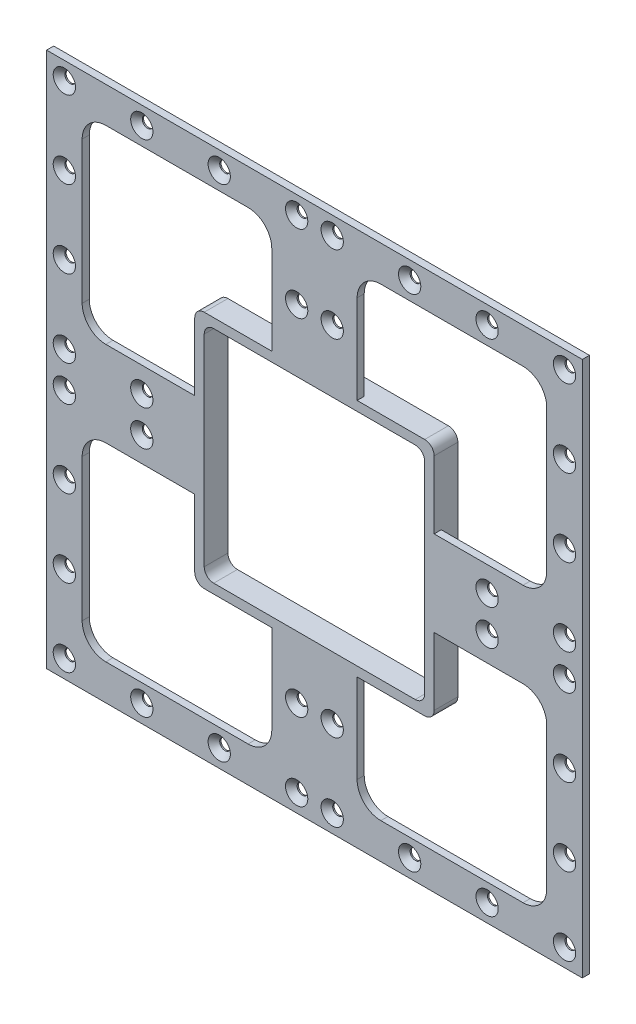
from build123d import *

# Parameters (mm, degrees)
SKETCH1_W              = 226
SKETCH1_H              = 226
BOSS_EXTRUDE1_DEPTH    = 3
SKETCH2_W              = 80
SKETCH2_H              = 80
CUT_EXTRUDE2_DEPTH     = 160.834289187
FILLET1_R              = 10
LPATTERN2_COUNT        = 2
LPATTERN2_PITCH        = 116
LPATTERN2_COUNT_DIR2   = 2
LPATTERN2_PITCH_DIR2   = 116
FILLET1_OF_LPATTERN2_R = 10
LPATTERN8_COUNT        = 4
LPATTERN8_PITCH        = 32.666666667
LPATTERN8_COUNT_DIR2   = 4
LPATTERN8_PITCH_DIR2   = 32.666666667
CUT_EXTRUDE3_REACH     = 161.834
SKETCH14_W             = 101
SKETCH14_H             = 101
SKETCH15_W             = 101
SKETCH15_H             = 101
SKETCH15_W_2           = 93
SKETCH15_H_2           = 93
BOSS_EXTRUDE2_DEPTH    = 10
FILLET2_R              = 4


with BuildPart() as part:
    # Sketch1 → Boss-Extrude1 (new body)
    with BuildSketch(Plane.XY):
        Rectangle(SKETCH1_W, SKETCH1_H)
    extrude(amount=BOSS_EXTRUDE1_DEPTH)

    # Sketch2 → Cut-Extrude2 (cut, through all)
    with BuildSketch(Plane.XY):
        with Locations((-58, 58)):
            Rectangle(SKETCH2_W, SKETCH2_H)
    cut_extrude2 = extrude(amount=CUT_EXTRUDE2_DEPTH, mode=Mode.SUBTRACT)

    # Fillet1
    fillet1_edges = [part.edges().sort_by_distance(p)[0] for p in [
        (-98, 98, 1.5),
        (-18, 98, 1.5),
        (-18, 18, 1.5),
        (-98, 18, 1.5),
    ]]
    fillet(fillet1_edges, radius=FILLET1_R)

    # LPattern2: Cut-Extrude2 2 × 2
    with Locations(*[(j * LPATTERN2_PITCH_DIR2, -i * LPATTERN2_PITCH, 0) for i in range(LPATTERN2_COUNT) for j in range(LPATTERN2_COUNT_DIR2) if (i, j) != (0, 0)]):
        add(cut_extrude2, mode=Mode.SUBTRACT)

    # Fillet1 of LPattern2
    fillet1_of_lpattern2_edges = [part.edges().sort_by_distance(p)[0] for p in [
        (18, 98, 1.5),
        (98, 98, 1.5),
        (98, 18, 1.5),
        (18, 18, 1.5),
        (-98, -18, 1.5),
        (-18, -18, 1.5),
        (-18, -98, 1.5),
        (-98, -98, 1.5),
        (18, -18, 1.5),
        (98, -18, 1.5),
        (98, -98, 1.5),
        (18, -98, 1.5),
    ]]
    fillet(fillet1_of_lpattern2_edges, radius=FILLET1_OF_LPATTERN2_R)

    # Sketch12 → CSK for M4 Flat Head Machine Screw4 (revolve, cut)
    with BuildSketch(Plane(origin=(-105.5, 105.5, 3), x_dir=(0, -1, 0), z_dir=(1, 0, 0))):
        Polygon((0, 0), (0, 3), (2.25, 3), (2.25, 2.45), (4.7, 0), align=None)
    csk_for_m4_flat_head_machine_screw4 = revolve(axis=Axis((-105.5, 105.5, 9.35), (0, 0, -1)), mode=Mode.SUBTRACT)

    # LPattern8: CSK for M4 Flat Head Machine Screw4 4 × 4, 4 skipped
    with Locations(*[(i * LPATTERN8_PITCH, -j * LPATTERN8_PITCH_DIR2, 0) for i in range(LPATTERN8_COUNT) for j in range(LPATTERN8_COUNT_DIR2) if (i, j) not in ((0, 0), (1, 1), (1, 2), (2, 1), (2, 2))]):
        add(csk_for_m4_flat_head_machine_screw4, mode=Mode.SUBTRACT)

    # Mirror1 copy 1 sketch → Mirror1 copy 1 (revolve, cut)
    with BuildSketch(Plane(origin=(105.5, 72.833333333, 3), x_dir=(0, -1, 0), z_dir=(-1, 0, 0))):
        Polygon((0, 0), (0, -3), (2.25, -3), (2.25, -2.45), (4.7, 0), align=None)
    revolve(axis=Axis((105.5, 72.833333333, 9.35), (0, 0, 1)), mode=Mode.SUBTRACT)

    # Mirror1 copy 2 sketch → Mirror1 copy 2 (revolve, cut)
    with BuildSketch(Plane(origin=(105.5, 40.166666667, 3), x_dir=(0, -1, 0), z_dir=(-1, 0, 0))):
        Polygon((0, 0), (0, -3), (2.25, -3), (2.25, -2.45), (4.7, 0), align=None)
    revolve(axis=Axis((105.5, 40.166666667, 9.35), (0, 0, 1)), mode=Mode.SUBTRACT)

    # Mirror1 copy 3 sketch → Mirror1 copy 3 (revolve, cut)
    with BuildSketch(Plane(origin=(105.5, 7.5, 3), x_dir=(0, -1, 0), z_dir=(-1, 0, 0))):
        Polygon((0, 0), (0, -3), (2.25, -3), (2.25, -2.45), (4.7, 0), align=None)
    revolve(axis=Axis((105.5, 7.5, 9.35), (0, 0, 1)), mode=Mode.SUBTRACT)

    # Mirror1 copy 4 sketch → Mirror1 copy 4 (revolve, cut)
    with BuildSketch(Plane(origin=(72.833333333, 105.5, 3), x_dir=(0, -1, 0), z_dir=(-1, 0, 0))):
        Polygon((0, 0), (0, -3), (2.25, -3), (2.25, -2.45), (4.7, 0), align=None)
    revolve(axis=Axis((72.833333333, 105.5, 9.35), (0, 0, 1)), mode=Mode.SUBTRACT)

    # Mirror1 copy 5 sketch → Mirror1 copy 5 (revolve, cut)
    with BuildSketch(Plane(origin=(72.833333333, 7.5, 3), x_dir=(0, -1, 0), z_dir=(-1, 0, 0))):
        Polygon((0, 0), (0, -3), (2.25, -3), (2.25, -2.45), (4.7, 0), align=None)
    revolve(axis=Axis((72.833333333, 7.5, 9.35), (0, 0, 1)), mode=Mode.SUBTRACT)

    # Mirror1 copy 6 sketch → Mirror1 copy 6 (revolve, cut)
    with BuildSketch(Plane(origin=(40.166666667, 105.5, 3), x_dir=(0, -1, 0), z_dir=(-1, 0, 0))):
        Polygon((0, 0), (0, -3), (2.25, -3), (2.25, -2.45), (4.7, 0), align=None)
    revolve(axis=Axis((40.166666667, 105.5, 9.35), (0, 0, 1)), mode=Mode.SUBTRACT)

    # Mirror1 copy 7 sketch → Mirror1 copy 7 (revolve, cut)
    with BuildSketch(Plane(origin=(40.166666667, 7.5, 3), x_dir=(0, -1, 0), z_dir=(-1, 0, 0))):
        Polygon((0, 0), (0, -3), (2.25, -3), (2.25, -2.45), (4.7, 0), align=None)
    revolve(axis=Axis((40.166666667, 7.5, 9.35), (0, 0, 1)), mode=Mode.SUBTRACT)

    # Mirror1 copy 8 sketch → Mirror1 copy 8 (revolve, cut)
    with BuildSketch(Plane(origin=(7.5, 105.5, 3), x_dir=(0, -1, 0), z_dir=(-1, 0, 0))):
        Polygon((0, 0), (0, -3), (2.25, -3), (2.25, -2.45), (4.7, 0), align=None)
    revolve(axis=Axis((7.5, 105.5, 9.35), (0, 0, 1)), mode=Mode.SUBTRACT)

    # Mirror1 copy 9 sketch → Mirror1 copy 9 (revolve, cut)
    with BuildSketch(Plane(origin=(7.5, 72.833333333, 3), x_dir=(0, -1, 0), z_dir=(-1, 0, 0))):
        Polygon((0, 0), (0, -3), (2.25, -3), (2.25, -2.45), (4.7, 0), align=None)
    revolve(axis=Axis((7.5, 72.833333333, 9.35), (0, 0, 1)), mode=Mode.SUBTRACT)

    # Mirror1 copy 10 sketch → Mirror1 copy 10 (revolve, cut)
    with BuildSketch(Plane(origin=(7.5, 40.166666667, 3), x_dir=(0, -1, 0), z_dir=(-1, 0, 0))):
        Polygon((0, 0), (0, -3), (2.25, -3), (2.25, -2.45), (4.7, 0), align=None)
    revolve(axis=Axis((7.5, 40.166666667, 9.35), (0, 0, 1)), mode=Mode.SUBTRACT)

    # Mirror1 copy 11 sketch → Mirror1 copy 11 (revolve, cut)
    with BuildSketch(Plane(origin=(7.5, 7.5, 3), x_dir=(0, -1, 0), z_dir=(-1, 0, 0))):
        Polygon((0, 0), (0, -3), (2.25, -3), (2.25, -2.45), (4.7, 0), align=None)
    revolve(axis=Axis((7.5, 7.5, 9.35), (0, 0, 1)), mode=Mode.SUBTRACT)

    # Mirror1 copy 12 sketch → Mirror1 copy 12 (revolve, cut)
    with BuildSketch(Plane(origin=(105.5, 105.5, 3), x_dir=(0, -1, 0), z_dir=(-1, 0, 0))):
        Polygon((0, 0), (0, -3), (2.25, -3), (2.25, -2.45), (4.7, 0), align=None)
    revolve(axis=Axis((105.5, 105.5, 9.35), (0, 0, 1)), mode=Mode.SUBTRACT)

    # Mirror1 at the second plane copy 1 sketc → Mirror1 at the second plane copy 1 (revolve, cut)
    with BuildSketch(Plane(origin=(-105.5, -72.833333333, 3), x_dir=(0, 1, 0), z_dir=(1, 0, 0))):
        Polygon((0, 0), (0, -3), (2.25, -3), (2.25, -2.45), (4.7, 0), align=None)
    revolve(axis=Axis((-105.5, -72.833333333, 9.35), (0, 0, 1)), mode=Mode.SUBTRACT)

    # Mirror1 at the second plane copy 2 sketc → Mirror1 at the second plane copy 2 (revolve, cut)
    with BuildSketch(Plane(origin=(-105.5, -40.166666667, 3), x_dir=(0, 1, 0), z_dir=(1, 0, 0))):
        Polygon((0, 0), (0, -3), (2.25, -3), (2.25, -2.45), (4.7, 0), align=None)
    revolve(axis=Axis((-105.5, -40.166666667, 9.35), (0, 0, 1)), mode=Mode.SUBTRACT)

    # Mirror1 at the second plane copy 3 sketc → Mirror1 at the second plane copy 3 (revolve, cut)
    with BuildSketch(Plane(origin=(-105.5, -7.5, 3), x_dir=(0, 1, 0), z_dir=(1, 0, 0))):
        Polygon((0, 0), (0, -3), (2.25, -3), (2.25, -2.45), (4.7, 0), align=None)
    revolve(axis=Axis((-105.5, -7.5, 9.35), (0, 0, 1)), mode=Mode.SUBTRACT)

    # Mirror1 at the second plane copy 4 sketc → Mirror1 at the second plane copy 4 (revolve, cut)
    with BuildSketch(Plane(origin=(-72.833333333, -105.5, 3), x_dir=(0, 1, 0), z_dir=(1, 0, 0))):
        Polygon((0, 0), (0, -3), (2.25, -3), (2.25, -2.45), (4.7, 0), align=None)
    revolve(axis=Axis((-72.833333333, -105.5, 9.35), (0, 0, 1)), mode=Mode.SUBTRACT)

    # Mirror1 at the second plane copy 5 sketc → Mirror1 at the second plane copy 5 (revolve, cut)
    with BuildSketch(Plane(origin=(-72.833333333, -7.5, 3), x_dir=(0, 1, 0), z_dir=(1, 0, 0))):
        Polygon((0, 0), (0, -3), (2.25, -3), (2.25, -2.45), (4.7, 0), align=None)
    revolve(axis=Axis((-72.833333333, -7.5, 9.35), (0, 0, 1)), mode=Mode.SUBTRACT)

    # Mirror1 at the second plane copy 6 sketc → Mirror1 at the second plane copy 6 (revolve, cut)
    with BuildSketch(Plane(origin=(-40.166666667, -105.5, 3), x_dir=(0, 1, 0), z_dir=(1, 0, 0))):
        Polygon((0, 0), (0, -3), (2.25, -3), (2.25, -2.45), (4.7, 0), align=None)
    revolve(axis=Axis((-40.166666667, -105.5, 9.35), (0, 0, 1)), mode=Mode.SUBTRACT)

    # Mirror1 at the second plane copy 7 sketc → Mirror1 at the second plane copy 7 (revolve, cut)
    with BuildSketch(Plane(origin=(-40.166666667, -7.5, 3), x_dir=(0, 1, 0), z_dir=(1, 0, 0))):
        Polygon((0, 0), (0, -3), (2.25, -3), (2.25, -2.45), (4.7, 0), align=None)
    revolve(axis=Axis((-40.166666667, -7.5, 9.35), (0, 0, 1)), mode=Mode.SUBTRACT)

    # Mirror1 at the second plane copy 8 sketc → Mirror1 at the second plane copy 8 (revolve, cut)
    with BuildSketch(Plane(origin=(-7.5, -105.5, 3), x_dir=(0, 1, 0), z_dir=(1, 0, 0))):
        Polygon((0, 0), (0, -3), (2.25, -3), (2.25, -2.45), (4.7, 0), align=None)
    revolve(axis=Axis((-7.5, -105.5, 9.35), (0, 0, 1)), mode=Mode.SUBTRACT)

    # Mirror1 at the second plane copy 9 sketc → Mirror1 at the second plane copy 9 (revolve, cut)
    with BuildSketch(Plane(origin=(-7.5, -72.833333333, 3), x_dir=(0, 1, 0), z_dir=(1, 0, 0))):
        Polygon((0, 0), (0, -3), (2.25, -3), (2.25, -2.45), (4.7, 0), align=None)
    revolve(axis=Axis((-7.5, -72.833333333, 9.35), (0, 0, 1)), mode=Mode.SUBTRACT)

    # Mirror1 at the second plane copy 10 sket → Mirror1 at the second plane copy 10 (revolve, cut)
    with BuildSketch(Plane(origin=(-7.5, -40.166666667, 3), x_dir=(0, 1, 0), z_dir=(1, 0, 0))):
        Polygon((0, 0), (0, -3), (2.25, -3), (2.25, -2.45), (4.7, 0), align=None)
    revolve(axis=Axis((-7.5, -40.166666667, 9.35), (0, 0, 1)), mode=Mode.SUBTRACT)

    # Mirror1 at the second plane copy 11 sket → Mirror1 at the second plane copy 11 (revolve, cut)
    with BuildSketch(Plane(origin=(-7.5, -7.5, 3), x_dir=(0, 1, 0), z_dir=(1, 0, 0))):
        Polygon((0, 0), (0, -3), (2.25, -3), (2.25, -2.45), (4.7, 0), align=None)
    revolve(axis=Axis((-7.5, -7.5, 9.35), (0, 0, 1)), mode=Mode.SUBTRACT)

    # Mirror1 at the second plane copy 12 sket → Mirror1 at the second plane copy 12 (revolve, cut)
    with BuildSketch(Plane(origin=(-105.5, -105.5, 3), x_dir=(0, 1, 0), z_dir=(1, 0, 0))):
        Polygon((0, 0), (0, -3), (2.25, -3), (2.25, -2.45), (4.7, 0), align=None)
    revolve(axis=Axis((-105.5, -105.5, 9.35), (0, 0, 1)), mode=Mode.SUBTRACT)

    # Mirror1 at the second plane copy 13 sket → Mirror1 at the second plane copy 13 (revolve, cut)
    with BuildSketch(Plane(origin=(105.5, -72.833333333, 3), x_dir=(0, 1, 0), z_dir=(-1, 0, 0))):
        Polygon((0, 0), (0, 3), (2.25, 3), (2.25, 2.45), (4.7, 0), align=None)
    revolve(axis=Axis((105.5, -72.833333333, 9.35), (0, 0, -1)), mode=Mode.SUBTRACT)

    # Mirror1 at the second plane copy 14 sket → Mirror1 at the second plane copy 14 (revolve, cut)
    with BuildSketch(Plane(origin=(105.5, -40.166666667, 3), x_dir=(0, 1, 0), z_dir=(-1, 0, 0))):
        Polygon((0, 0), (0, 3), (2.25, 3), (2.25, 2.45), (4.7, 0), align=None)
    revolve(axis=Axis((105.5, -40.166666667, 9.35), (0, 0, -1)), mode=Mode.SUBTRACT)

    # Mirror1 at the second plane copy 15 sket → Mirror1 at the second plane copy 15 (revolve, cut)
    with BuildSketch(Plane(origin=(105.5, -7.5, 3), x_dir=(0, 1, 0), z_dir=(-1, 0, 0))):
        Polygon((0, 0), (0, 3), (2.25, 3), (2.25, 2.45), (4.7, 0), align=None)
    revolve(axis=Axis((105.5, -7.5, 9.35), (0, 0, -1)), mode=Mode.SUBTRACT)

    # Mirror1 at the second plane copy 16 sket → Mirror1 at the second plane copy 16 (revolve, cut)
    with BuildSketch(Plane(origin=(72.833333333, -105.5, 3), x_dir=(0, 1, 0), z_dir=(-1, 0, 0))):
        Polygon((0, 0), (0, 3), (2.25, 3), (2.25, 2.45), (4.7, 0), align=None)
    revolve(axis=Axis((72.833333333, -105.5, 9.35), (0, 0, -1)), mode=Mode.SUBTRACT)

    # Mirror1 at the second plane copy 17 sket → Mirror1 at the second plane copy 17 (revolve, cut)
    with BuildSketch(Plane(origin=(72.833333333, -7.5, 3), x_dir=(0, 1, 0), z_dir=(-1, 0, 0))):
        Polygon((0, 0), (0, 3), (2.25, 3), (2.25, 2.45), (4.7, 0), align=None)
    revolve(axis=Axis((72.833333333, -7.5, 9.35), (0, 0, -1)), mode=Mode.SUBTRACT)

    # Mirror1 at the second plane copy 18 sket → Mirror1 at the second plane copy 18 (revolve, cut)
    with BuildSketch(Plane(origin=(40.166666667, -105.5, 3), x_dir=(0, 1, 0), z_dir=(-1, 0, 0))):
        Polygon((0, 0), (0, 3), (2.25, 3), (2.25, 2.45), (4.7, 0), align=None)
    revolve(axis=Axis((40.166666667, -105.5, 9.35), (0, 0, -1)), mode=Mode.SUBTRACT)

    # Mirror1 at the second plane copy 19 sket → Mirror1 at the second plane copy 19 (revolve, cut)
    with BuildSketch(Plane(origin=(40.166666667, -7.5, 3), x_dir=(0, 1, 0), z_dir=(-1, 0, 0))):
        Polygon((0, 0), (0, 3), (2.25, 3), (2.25, 2.45), (4.7, 0), align=None)
    revolve(axis=Axis((40.166666667, -7.5, 9.35), (0, 0, -1)), mode=Mode.SUBTRACT)

    # Mirror1 at the second plane copy 20 sket → Mirror1 at the second plane copy 20 (revolve, cut)
    with BuildSketch(Plane(origin=(7.5, -105.5, 3), x_dir=(0, 1, 0), z_dir=(-1, 0, 0))):
        Polygon((0, 0), (0, 3), (2.25, 3), (2.25, 2.45), (4.7, 0), align=None)
    revolve(axis=Axis((7.5, -105.5, 9.35), (0, 0, -1)), mode=Mode.SUBTRACT)

    # Mirror1 at the second plane copy 21 sket → Mirror1 at the second plane copy 21 (revolve, cut)
    with BuildSketch(Plane(origin=(7.5, -72.833333333, 3), x_dir=(0, 1, 0), z_dir=(-1, 0, 0))):
        Polygon((0, 0), (0, 3), (2.25, 3), (2.25, 2.45), (4.7, 0), align=None)
    revolve(axis=Axis((7.5, -72.833333333, 9.35), (0, 0, -1)), mode=Mode.SUBTRACT)

    # Mirror1 at the second plane copy 22 sket → Mirror1 at the second plane copy 22 (revolve, cut)
    with BuildSketch(Plane(origin=(7.5, -40.166666667, 3), x_dir=(0, 1, 0), z_dir=(-1, 0, 0))):
        Polygon((0, 0), (0, 3), (2.25, 3), (2.25, 2.45), (4.7, 0), align=None)
    revolve(axis=Axis((7.5, -40.166666667, 9.35), (0, 0, -1)), mode=Mode.SUBTRACT)

    # Mirror1 at the second plane copy 23 sket → Mirror1 at the second plane copy 23 (revolve, cut)
    with BuildSketch(Plane(origin=(7.5, -7.5, 3), x_dir=(0, 1, 0), z_dir=(-1, 0, 0))):
        Polygon((0, 0), (0, 3), (2.25, 3), (2.25, 2.45), (4.7, 0), align=None)
    revolve(axis=Axis((7.5, -7.5, 9.35), (0, 0, -1)), mode=Mode.SUBTRACT)

    # Mirror1 at the second plane copy 24 sket → Mirror1 at the second plane copy 24 (revolve, cut)
    with BuildSketch(Plane(origin=(105.5, -105.5, 3), x_dir=(0, 1, 0), z_dir=(-1, 0, 0))):
        Polygon((0, 0), (0, 3), (2.25, 3), (2.25, 2.45), (4.7, 0), align=None)
    revolve(axis=Axis((105.5, -105.5, 9.35), (0, 0, -1)), mode=Mode.SUBTRACT)

    # Mirror1 at the second plane copy 25 sket → Mirror1 at the second plane copy 25 (revolve, cut)
    with BuildSketch(Plane(origin=(-105.5, -105.5, 3), x_dir=(0, 1, 0), z_dir=(1, 0, 0))):
        Polygon((0, 0), (0, -3), (2.25, -3), (2.25, -2.45), (4.7, 0), align=None)
    revolve(axis=Axis((-105.5, -105.5, 9.35), (0, 0, 1)), mode=Mode.SUBTRACT)

    # Sketch14 → Cut-Extrude3 (cut, up to next)
    with BuildSketch(Plane.XY.offset(3), mode=Mode.PRIVATE) as cut_extrude3_sk1:
        Rectangle(SKETCH14_W, SKETCH14_H)
    cut_extrude3_tool1 = extrude(cut_extrude3_sk1.sketch, amount=-CUT_EXTRUDE3_REACH, mode=Mode.PRIVATE) & part.part
    add(cut_extrude3_tool1.solids().sort_by_distance((0, 0, 3))[0], mode=Mode.SUBTRACT)

    # Sketch15 → Boss-Extrude2 (add)
    with BuildSketch(Plane.XY.offset(3)):
        Rectangle(SKETCH15_W, SKETCH15_H)
        Rectangle(SKETCH15_W_2, SKETCH15_H_2, mode=Mode.SUBTRACT)
    extrude(amount=-BOSS_EXTRUDE2_DEPTH)

    # Fillet2
    fillet2_edges = [part.edges().sort_by_distance(p)[0] for p in [
        (-46.5, -46.5, -2),
        (-50.5, -50.5, -2),
        (46.5, -46.5, -2),
        (50.5, -50.5, -2),
        (46.5, 46.5, -2),
        (50.5, 50.5, -2),
        (-46.5, 46.5, -2),
        (-50.5, 50.5, -2),
    ]]
    fillet(fillet2_edges, radius=FILLET2_R)


solid = part.part
